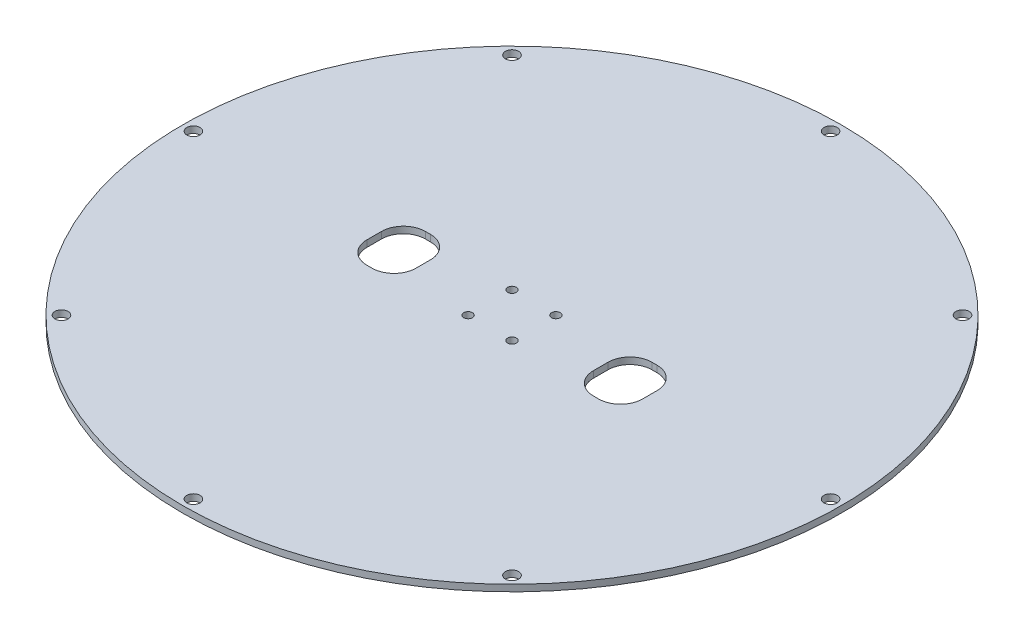
from build123d import *

# Parameters (mm, degrees)
EXTRUDE_1_OUTLINE_R   = 150
EXTRUDE_1_OUTLINE_R_2 = 3
EXTRUDE_1_OUTLINE_R_3 = 2
EXTRUDE_1_OUTLINE_W   = 22.346122356
EXTRUDE_1_OUTLINE_H   = 26.623931282
EXTRUDE_1_DEPTH       = 3
FILLET_1_R            = 10
FILLET_2_R            = 10
FILLET_3_R            = 10
FILLET_4_R            = 10
FILLET_5_R            = 10
FILLET_6_R            = 10
FILLET_7_R            = 10
FILLET_8_R            = 10


# Read off the part's stored shape, not the designer's step: Бобышка-Вытянуть1
with BuildPart() as part:
    # Бобышка-Вытянуть1 outline → Бобышка-Вытянуть1 (new body)
    with BuildSketch(Plane(origin=(0, 0, 0), x_dir=(1, 0, 0), z_dir=(0, 1, 0))):
        Circle(EXTRUDE_1_OUTLINE_R)
        with Locations((-102.530483272, -102.530483272)):
            Circle(EXTRUDE_1_OUTLINE_R_2, mode=Mode.SUBTRACT)
        with Locations((-10, -10)):
            Circle(EXTRUDE_1_OUTLINE_R_3, mode=Mode.SUBTRACT)
        with Locations((0, -145)):
            Circle(EXTRUDE_1_OUTLINE_R_2, mode=Mode.SUBTRACT)
        with Locations((102.530483272, -102.530483272)):
            Circle(EXTRUDE_1_OUTLINE_R_2, mode=Mode.SUBTRACT)
        with Locations((10, -10)):
            Circle(EXTRUDE_1_OUTLINE_R_3, mode=Mode.SUBTRACT)
        with Locations((-145, 0)):
            Circle(EXTRUDE_1_OUTLINE_R_2, mode=Mode.SUBTRACT)
        with Locations((-51.559180368, 0)):
            Rectangle(EXTRUDE_1_OUTLINE_W, EXTRUDE_1_OUTLINE_H, mode=Mode.SUBTRACT)
        with Locations((-10, 10)):
            Circle(EXTRUDE_1_OUTLINE_R_3, mode=Mode.SUBTRACT)
        with Locations((-102.530483272, 102.530483272)):
            Circle(EXTRUDE_1_OUTLINE_R_2, mode=Mode.SUBTRACT)
        with Locations((10, 10)):
            Circle(EXTRUDE_1_OUTLINE_R_3, mode=Mode.SUBTRACT)
        with Locations((51.559180368, 0)):
            Rectangle(EXTRUDE_1_OUTLINE_W, EXTRUDE_1_OUTLINE_H, mode=Mode.SUBTRACT)
        with Locations((145, 0)):
            Circle(EXTRUDE_1_OUTLINE_R_2, mode=Mode.SUBTRACT)
        with Locations((0, 145)):
            Circle(EXTRUDE_1_OUTLINE_R_2, mode=Mode.SUBTRACT)
        with Locations((102.530483272, 102.530483272)):
            Circle(EXTRUDE_1_OUTLINE_R_2, mode=Mode.SUBTRACT)
    extrude(amount=EXTRUDE_1_DEPTH)

    # Скругление1
    fillet_1_edges = [part.edges().sort_by_distance(p)[0] for p in [
        (-62.732241546, 1.5, -13.311965641),
    ]]
    fillet(fillet_1_edges, radius=FILLET_1_R)

    # Скругление2
    fillet_2_edges = [part.edges().sort_by_distance(p)[0] for p in [
        (-40.38611919, 1.5, 13.311965641),
    ]]
    fillet(fillet_2_edges, radius=FILLET_2_R)

    # Скругление3
    fillet_3_edges = [part.edges().sort_by_distance(p)[0] for p in [
        (40.38611919, 1.5, 13.311965641),
    ]]
    fillet(fillet_3_edges, radius=FILLET_3_R)

    # Скругление4
    fillet_4_edges = [part.edges().sort_by_distance(p)[0] for p in [
        (62.732241546, 1.5, -13.311965641),
    ]]
    fillet(fillet_4_edges, radius=FILLET_4_R)

    # Скругление5
    fillet_5_edges = [part.edges().sort_by_distance(p)[0] for p in [
        (-40.38611919, 1.5, -13.311965641),
    ]]
    fillet(fillet_5_edges, radius=FILLET_5_R)

    # Скругление6
    fillet_6_edges = [part.edges().sort_by_distance(p)[0] for p in [
        (-62.732241546, 1.5, 13.311965641),
    ]]
    fillet(fillet_6_edges, radius=FILLET_6_R)

    # Скругление7
    fillet_7_edges = [part.edges().sort_by_distance(p)[0] for p in [
        (62.732241546, 1.5, 13.311965641),
    ]]
    fillet(fillet_7_edges, radius=FILLET_7_R)

    # Скругление8
    fillet_8_edges = [part.edges().sort_by_distance(p)[0] for p in [
        (40.38611919, 1.5, -13.311965641),
    ]]
    fillet(fillet_8_edges, radius=FILLET_8_R)


solid = part.part
